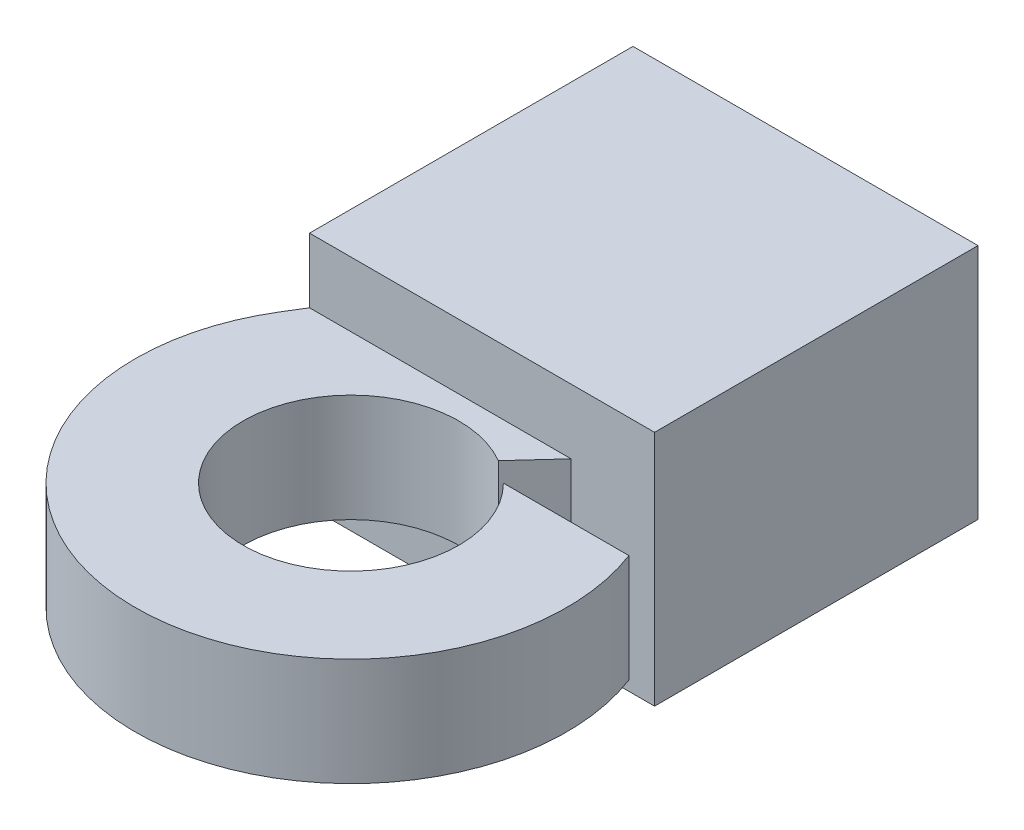
from build123d import *

# Parameters (mm, degrees)
SKETCH_1_W          = 7.5
SKETCH_1_H          = 5.5
EXTRUDE_1_DEPTH     = 8
EXTRUDE_3_DEPTH     = 1.25
SKETCH_5_W          = 6
SKETCH_5_H          = 4
CUT_EXTRUDE_1_DEPTH = 7
SKETCH_6_W          = 6
SKETCH_6_H          = 0.3
EXTRUDE_4_DEPTH     = 0.6


with BuildPart() as part:
    # 草图1 → 凸台-拉伸1 (new body)
    with BuildSketch(Plane(origin=(0, 0, 0), x_dir=(0, 0, -1), z_dir=(1, 0, 0))):
        Rectangle(SKETCH_1_W, SKETCH_1_H)
    extrude(amount=EXTRUDE_1_DEPTH)

    # 草图4 → 凸台-拉伸3 (add, symmetric)
    with BuildSketch(Plane(origin=(0, 0, 0), x_dir=(1, 0, 0), z_dir=(0, 1, 0))):
        with BuildLine():
            Line((0, -3.75), (-0.258625805, -4.170387059))
            ThreePointArc((-0.258625805, -4.170387059), (3.525315207, -11.767747433), (8.677071733, -5.022564047))
            Line((8.677071733, -5.022564047), (5.767766953, -5.022564047))
            ThreePointArc((5.767766953, -5.022564047), (2.474107814, -8.770647397), (5.258704536, -4.630316442))
            Line((5.258704536, -4.630316442), (6.064710581, -3.75))
            Line((6.064710581, -3.75), (0, -3.75))
        make_face()
    extrude(amount=EXTRUDE_3_DEPTH, both=True)

    # 草图5 → 切除-拉伸1 (cut)
    with BuildSketch(Plane.ZY):
        Rectangle(SKETCH_5_W, SKETCH_5_H)
    extrude(amount=-CUT_EXTRUDE_1_DEPTH, mode=Mode.SUBTRACT)

    # 草图6 → 凸台-拉伸4 (add)
    with BuildSketch(Plane(origin=(0, 2.75, 0), x_dir=(1, 0, 0), z_dir=(0, 1, 0))):
        with Locations((4, 0)):
            Rectangle(SKETCH_6_W, SKETCH_6_H)
        with Locations((4, 1.205749971)):
            Rectangle(SKETCH_6_W, SKETCH_6_H)
        with Locations((4, -1.205749971)):
            Rectangle(SKETCH_6_W, SKETCH_6_H)
    extrude(amount=-EXTRUDE_4_DEPTH)


solid = part.part
